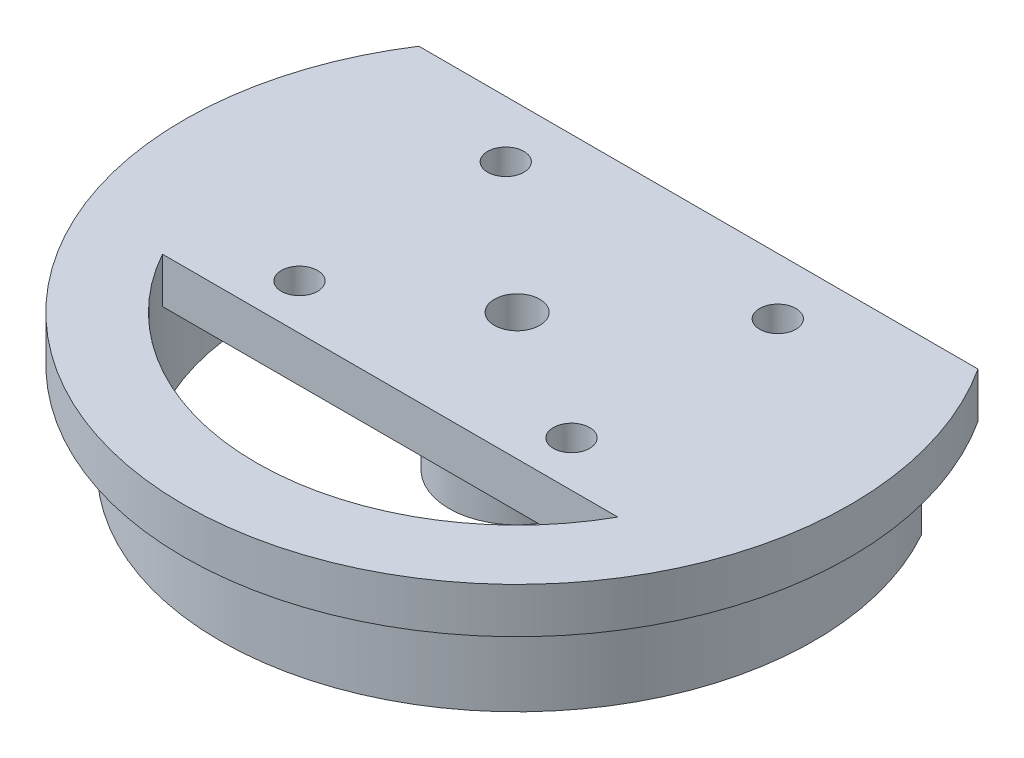
from build123d import *

# Parameters (mm, degrees)
CYLINDER_DEPTH          = 5
CYLINDER_DEPTH_BACK     = 10
SKETCH_1_R              = 7.5
SKETCH_1_R_2            = 2.5
SKETCH_2_R              = 36.75
SKETCH_2_R_2            = 2.5
BASE_HORIZONT_DEPTH     = 5
SKETCH_3_R              = 32.75
SKETCH_3_R_2            = 28.75
EDGE_2_DEPTH            = 15
PIE_REACH               = 56.094
CUTOFF_DEPTH            = 10
CUTOFF_DEPTH_BACK       = 10
SKETCH_8_W              = 61.662387238
SKETCH_8_H              = 16.75
MAIN_HORNS_HOLES_REACH  = 56.094
SKETCH_4_R              = 2
MINOR_HORNS_HOLES_REACH = 56.094
SKETCH_11_R             = 2
SKETCH_12_W             = 8
SKETCH_12_H             = 4
CUT_EXTRUDE_1_DEPTH     = 10


with BuildPart() as part:
    # Эскиз1 → cylinder (new, two sides: drawn at the far end of the back side and taken through both)
    with BuildSketch(Plane(origin=(0, 0, 0), x_dir=(1, 0, 0), z_dir=(0, 1, 0)).offset(-CYLINDER_DEPTH_BACK)):
        Circle(SKETCH_1_R)
        Circle(SKETCH_1_R_2, mode=Mode.SUBTRACT)
    extrude(amount=CYLINDER_DEPTH + CYLINDER_DEPTH_BACK)

    # Эскиз2 → base horizont (add)
    with BuildSketch(Plane(origin=(0, 0, 0), x_dir=(1, 0, 0), z_dir=(0, 1, 0))):
        Circle(SKETCH_2_R)
        Circle(SKETCH_2_R_2, mode=Mode.SUBTRACT)
    extrude(amount=BASE_HORIZONT_DEPTH)

    # Эскиз3 → edge 2 (add)
    with BuildSketch(Plane(origin=(0, 5, 0), x_dir=(1, 0, 0), z_dir=(0, 1, 0))):
        Circle(SKETCH_3_R)
        Circle(SKETCH_3_R_2, mode=Mode.SUBTRACT)
    extrude(amount=-EDGE_2_DEPTH)

    # Эскиз10 → pie (cut, up to next)
    with BuildSketch(Plane(origin=(0, 5, 0), x_dir=(1, 0, 0), z_dir=(0, 1, 0)), mode=Mode.PRIVATE) as pie_sk1:
        with BuildLine():
            Line((-25.111003564, -14), (25.111003564, -14))
            ThreePointArc((25.111003564, -14), (0, -28.75), (-25.111003564, -14))
        make_face()
    pie_tool1 = extrude(pie_sk1.sketch, amount=-PIE_REACH, mode=Mode.PRIVATE) & part.part
    add(pie_tool1.solids().sort_by_distance((0, 5, 20.052651))[0], mode=Mode.SUBTRACT)

    # Эскиз8 → cutoff (cut, two sides: drawn at the far end of the back side and taken through both)
    with BuildSketch(Plane(origin=(0, 0, 0), x_dir=(1, 0, 0), z_dir=(0, 1, 0)).offset(-CUTOFF_DEPTH_BACK)):
        with Locations((0, 28.375)):
            Rectangle(SKETCH_8_W, SKETCH_8_H)
    extrude(amount=CUTOFF_DEPTH + CUTOFF_DEPTH_BACK, mode=Mode.SUBTRACT)

    # Эскиз4 → main horns holes (cut, up to next)
    with BuildSketch(Plane(origin=(0, 5, 0), x_dir=(1, 0, 0), z_dir=(0, 1, 0)), mode=Mode.PRIVATE) as main_horns_holes_sk1:
        with Locations((-15, 13.75)):
            Circle(SKETCH_4_R)
    main_horns_holes_tool1 = extrude(main_horns_holes_sk1.sketch, amount=-MAIN_HORNS_HOLES_REACH, mode=Mode.PRIVATE) & part.part
    # Эскиз4 → main horns holes (cut, up to next)
    with BuildSketch(Plane(origin=(0, 5, 0), x_dir=(1, 0, 0), z_dir=(0, 1, 0)), mode=Mode.PRIVATE) as main_horns_holes_sk2:
        with Locations((15, 13.75)):
            Circle(SKETCH_4_R)
    main_horns_holes_tool2 = extrude(main_horns_holes_sk2.sketch, amount=-MAIN_HORNS_HOLES_REACH, mode=Mode.PRIVATE) & part.part
    add(main_horns_holes_tool1.solids().sort_by_distance((-15, 5, -13.75))[0], mode=Mode.SUBTRACT)
    add(main_horns_holes_tool2.solids().sort_by_distance((15, 5, -13.75))[0], mode=Mode.SUBTRACT)

    # Эскиз11 → minor horns holes (cut, up to next)
    with BuildSketch(Plane(origin=(0, 5, 0), x_dir=(1, 0, 0), z_dir=(0, 1, 0)), mode=Mode.PRIVATE) as minor_horns_holes_sk1:
        with Locations((-15, -9)):
            Circle(SKETCH_11_R)
    minor_horns_holes_tool1 = extrude(minor_horns_holes_sk1.sketch, amount=-MINOR_HORNS_HOLES_REACH, mode=Mode.PRIVATE) & part.part
    # Эскиз11 → minor horns holes (cut, up to next)
    with BuildSketch(Plane(origin=(0, 5, 0), x_dir=(1, 0, 0), z_dir=(0, 1, 0)), mode=Mode.PRIVATE) as minor_horns_holes_sk2:
        with Locations((15, -9)):
            Circle(SKETCH_11_R)
    minor_horns_holes_tool2 = extrude(minor_horns_holes_sk2.sketch, amount=-MINOR_HORNS_HOLES_REACH, mode=Mode.PRIVATE) & part.part
    add(minor_horns_holes_tool1.solids().sort_by_distance((-15, 5, 9))[0], mode=Mode.SUBTRACT)
    add(minor_horns_holes_tool2.solids().sort_by_distance((15, 5, 9))[0], mode=Mode.SUBTRACT)

    # Эскиз12 → Вытянуть1 (cut)
    with BuildSketch(Plane.XZ.offset(10)):
        with Locations((-24.575557737, -18)):
            Rectangle(SKETCH_12_W, SKETCH_12_H)
        with Locations((24.575557737, -18)):
            Rectangle(SKETCH_12_W, SKETCH_12_H)
    extrude(amount=-CUT_EXTRUDE_1_DEPTH, mode=Mode.SUBTRACT)


solid = part.part
